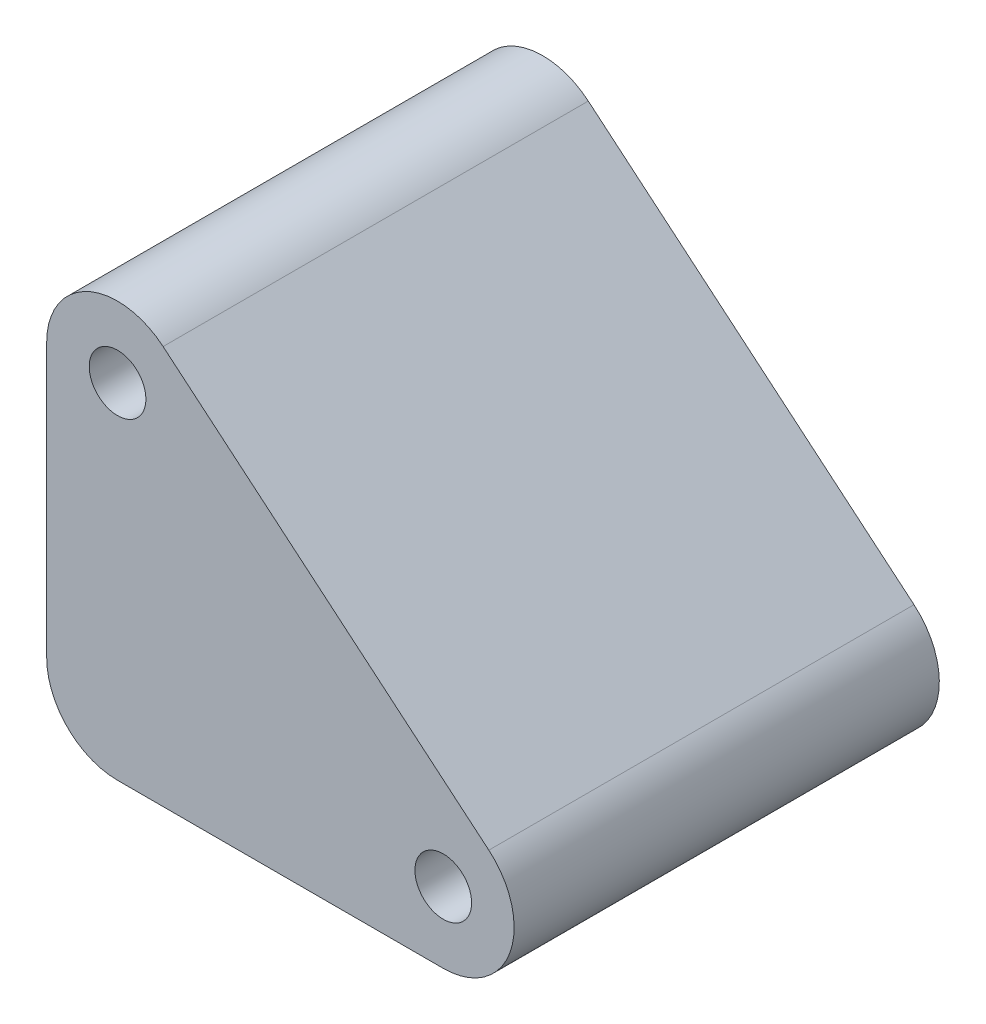
from build123d import *

# Parameters (mm, degrees)
BOSS_EXTRUDE1_DEPTH      = 15
BOSS_EXTRUDE1_DEPTH_BACK = 15
SKETCH1_R                = 2


with BuildPart() as part:
    # Sketch1 → Boss-Extrude1 (new, two sides: drawn at the far end of the back side and taken through both)
    with BuildSketch(Plane.XY.offset(-BOSS_EXTRUDE1_DEPTH_BACK)):
        with BuildLine():
            Line((-246.574339732, 135.388338696), (-223.593006439, 116.104710406))
            ThreePointArc((-223.593006439, 116.104710406), (-222.108481383, 110.564387474), (-226.806944487, 107.27448819))
            Line((-226.806944487, 107.27448819), (-249.788277781, 107.27448819))
            ThreePointArc((-249.788277781, 107.27448819), (-253.323811687, 108.738954284), (-254.788277781, 112.27448819))
            Line((-254.788277781, 112.27448819), (-254.788277781, 131.558116481))
            ThreePointArc((-254.788277781, 131.558116481), (-251.901369089, 136.089655416), (-246.574339732, 135.388338696))
        make_face()
        with Locations((-226.806944487, 112.27448819)):
            Circle(SKETCH1_R, mode=Mode.SUBTRACT)
        with Locations((-249.788277781, 131.558116481)):
            Circle(SKETCH1_R, mode=Mode.SUBTRACT)
    extrude(amount=BOSS_EXTRUDE1_DEPTH + BOSS_EXTRUDE1_DEPTH_BACK)


solid = part.part
